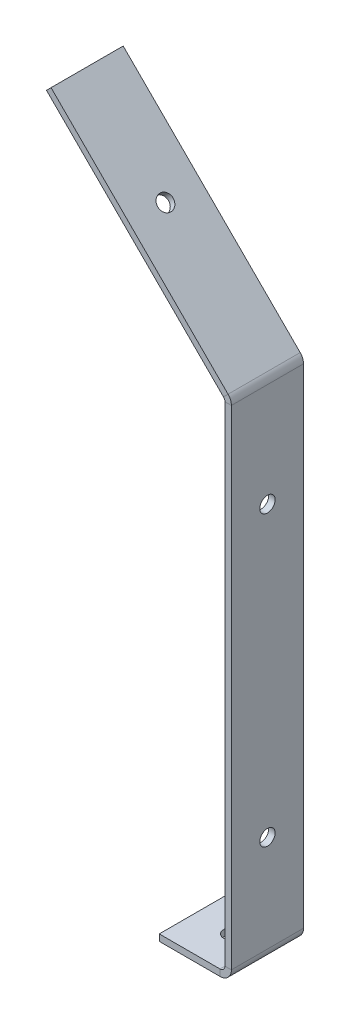
from build123d import *

# Parameters (mm, degrees)
BASE_FLANGE1_DEPTH = 25.4
CUT_EXTRUDE1_REACH = 253.219
SKETCH3_R          = 2.7051
CUT_EXTRUDE2_REACH = 220.156
SKETCH4_R          = 2.7051
CUT_EXTRUDE3_REACH = 253.219
SKETCH5_R          = 2.7051


# Sheet-metal steps are written as plain solids
with BuildPart() as part:
    # Sketch1 → Base-Flange1 (new body)
    with BuildSketch(Plane.XY):
        with BuildLine():
            Line((-25.4, 0), (-4.0132, 0))
            ThreePointArc((-4.0132, 0), (-1.175439066, 1.175439066), (0, 4.0132))
            Line((0, 4.0132), (0, 176.137678131))
            ThreePointArc((0, 176.137678131), (-0.30548666, 177.673463282), (-1.175439066, 178.975439066))
            Line((-1.175439066, 178.975439066), (-63.5, 241.3))
            Line((-63.5, 241.3), (-65.116446102, 239.683553898))
            Line((-65.116446102, 239.683553898), (-2.791885168, 177.358992964))
            ThreePointArc((-2.791885168, 177.358992964), (-2.417475271, 176.798648956), (-2.286, 176.137678131))
            Line((-2.286, 176.137678131), (-2.286, 4.0132))
            ThreePointArc((-2.286, 4.0132), (-2.791885168, 2.791885168), (-4.0132, 2.286))
            Line((-4.0132, 2.286), (-25.4, 2.286))
            Line((-25.4, 2.286), (-25.4, 0))
        make_face()
    extrude(amount=BASE_FLANGE1_DEPTH)

    # Sketch3 → Cut-Extrude1 (cut, up to next)
    with BuildSketch(Plane(origin=(0, 0, 0), x_dir=(0, 0, -1), z_dir=(1, 0, 0)), mode=Mode.PRIVATE) as cut_extrude1_sk1:
        with Locations((-12.7, 38.1)):
            Circle(SKETCH3_R)
    cut_extrude1_tool1 = extrude(cut_extrude1_sk1.sketch, amount=-CUT_EXTRUDE1_REACH, mode=Mode.PRIVATE) & part.part
    # Sketch3 → Cut-Extrude1 (cut, up to next)
    with BuildSketch(Plane(origin=(0, 0, 0), x_dir=(0, 0, -1), z_dir=(1, 0, 0)), mode=Mode.PRIVATE) as cut_extrude1_sk2:
        with Locations((-12.7, 139.7)):
            Circle(SKETCH3_R)
    cut_extrude1_tool2 = extrude(cut_extrude1_sk2.sketch, amount=-CUT_EXTRUDE1_REACH, mode=Mode.PRIVATE) & part.part
    add(cut_extrude1_tool1.solids().sort_by_distance((0, 38.1, 12.7))[0], mode=Mode.SUBTRACT)
    add(cut_extrude1_tool2.solids().sort_by_distance((0, 139.7, 12.7))[0], mode=Mode.SUBTRACT)

    # Sketch4 → Cut-Extrude2 (cut, up to next)
    with BuildSketch(Plane(origin=(88.9, 88.9, 0), x_dir=(0, 0, -1), z_dir=(0.7071067811865462, 0.7071067811865489, 0)), mode=Mode.PRIVATE) as cut_extrude2_sk1:
        with Locations(Location((-12.7, 176.523585695, 0), (0, 0, 90))):
            Circle(SKETCH4_R)
    cut_extrude2_tool1 = extrude(cut_extrude2_sk1.sketch, amount=-CUT_EXTRUDE2_REACH, mode=Mode.PRIVATE) & part.part
    add(cut_extrude2_tool1.solids().sort_by_distance((-35.921024, 213.721024, 12.7))[0], mode=Mode.SUBTRACT)

    # Sketch5 → Cut-Extrude3 (cut, up to next)
    with BuildSketch(Plane.XZ, mode=Mode.PRIVATE) as cut_extrude3_sk1:
        with Locations((-12.7, 12.7)):
            Circle(SKETCH5_R)
    cut_extrude3_tool1 = extrude(cut_extrude3_sk1.sketch, amount=-CUT_EXTRUDE3_REACH, mode=Mode.PRIVATE) & part.part
    add(cut_extrude3_tool1.solids().sort_by_distance((-12.7, 0, 12.7))[0], mode=Mode.SUBTRACT)


solid = part.part
